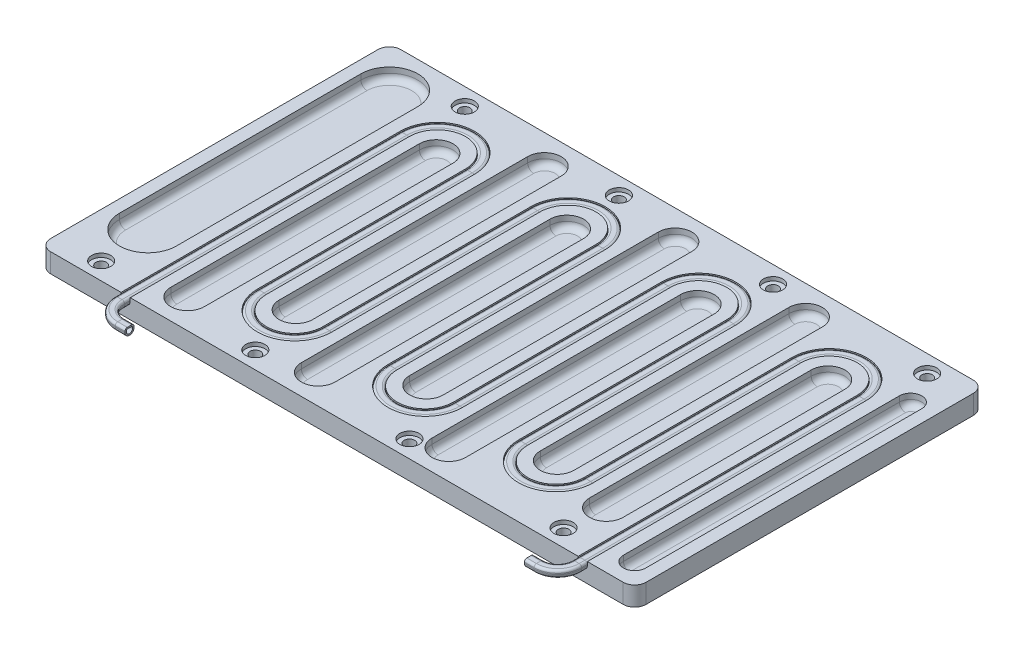
from build123d import *

# Parameters (mm, degrees)
SKETCH1_W           = 310
SKETCH1_H           = 182.3
BOSS_EXTRUDE1_DEPTH = 10
HOLE1_D             = 5.5
HOLE1_DEPTH         = 10
HOLE1_CBORE_D       = 10
HOLE1_CBORE_DEPTH   = 2
HOLE1_TIP           = 1.652366702
FILLET1_R           = 6
CUT_EXTRUDE1_DEPTH  = 6
FILLET2_R           = 3.175


with BuildPart() as part:
    # Sketch1 → Boss-Extrude1 (new body)
    with BuildSketch(Plane(origin=(0, 0, 0), x_dir=(1, 0, 0), z_dir=(0, 1, 0))):
        Rectangle(SKETCH1_W, SKETCH1_H)
    extrude(amount=BOSS_EXTRUDE1_DEPTH)

    # Hole1
    with Locations(Plane(origin=(0, 10, 0), x_dir=(1, 0, 0), z_dir=(0, 1, 0))):
        with Locations((-131.75, -82.15), (-106.75, 82.15), (-26.5, 82.15), (53.75, 82.15), (134, 82.15), (-51.5, -82.15), (28.75, -82.15), (109, -82.15)):
            CounterBoreHole(HOLE1_D / 2, HOLE1_CBORE_D / 2, HOLE1_CBORE_DEPTH, depth=HOLE1_DEPTH)
            with Locations((0, 0, -(HOLE1_DEPTH + HOLE1_TIP / 2))):  # 118° drill point
                Cone(0, HOLE1_D / 2, HOLE1_TIP, mode=Mode.SUBTRACT)

    # Fillet1
    fillet1_edges = [part.edges().sort_by_distance(p)[0] for p in [
        (155, 5, -91.15),
        (155, 5, 91.15),
        (-155, 5, -91.15),
        (-155, 5, 91.15),
    ]]
    fillet(fillet1_edges, radius=FILLET1_R)

    # Cut-Sweep1: sweep along a path in Sketch6
    with BuildLine(Plane(origin=(0, 10, 0), x_dir=(1, 0, 0), z_dir=(0, 1, 0))) as cut_sweep1_path:
        Line((-95, -104.15), (-100, -104.15))
        ThreePointArc((-100, -104.15), (-107.071067812, -101.221067812), (-110, -94.15))
        Line((-110, -94.15), (-110, -91.15))
        Line((-110, -91.15), (-110, 54.15))
        ThreePointArc((-110, 54.15), (-93, 71.15), (-76, 54.15))
        Line((-76, 54.15), (-76, -54.15))
        ThreePointArc((-76, -54.15), (-59, -71.15), (-42, -54.15))
        Line((-42, -54.15), (-42, 54.15))
        ThreePointArc((-42, 54.15), (-25, 71.15), (-8, 54.15))
        Line((-8, 54.15), (-8, -54.15))
        ThreePointArc((-8, -54.15), (9, -71.15), (26, -54.15))
        Line((26, -54.15), (26, 54.15))
        ThreePointArc((26, 54.15), (43, 71.15), (60, 54.15))
        Line((60, 54.15), (60, -54.15))
        ThreePointArc((60, -54.15), (77, -71.15), (94, -54.15))
        Line((94, -54.15), (94, 54.15))
        ThreePointArc((94, 54.15), (111, 71.15), (128, 54.15))
        Line((128, 54.15), (128, -91.15))
        Line((128, -91.15), (128, -94.15))
        ThreePointArc((128, -94.15), (125.071067812, -101.221067812), (118, -104.15))
        Line((118, -104.15), (113, -104.15))
    # Sketch7 → Cut-Sweep1 (sweep, cut)
    with BuildSketch(Plane.XY.offset(91.15)):
        with BuildLine():
            Line((-112.38125, 8.2), (-112.38125, 10))
            Line((-112.38125, 10), (-107.61875, 10))
            Line((-107.61875, 10), (-107.61875, 8.2))
            ThreePointArc((-107.61875, 8.2), (-110, 5.81875), (-112.38125, 8.2))
        make_face()
    sweep(path=cut_sweep1_path.line, mode=Mode.SUBTRACT)

    # Sketch9 → Cut-Extrude1 (cut)
    with BuildSketch(Plane(origin=(0, 10, 0), x_dir=(1, 0, 0), z_dir=(0, 1, 0))):
        with BuildLine():
            Line((-148.5, 69.840625), (-148.5, -55.840625))
            ThreePointArc((-148.5, -55.840625), (-133.690625, -70.65), (-118.88125, -55.840625))
            Line((-118.88125, -55.840625), (-118.88125, 69.840625))
            ThreePointArc((-118.88125, 69.840625), (-133.690625, 84.65), (-148.5, 69.840625))
        make_face()
        with BuildLine():
            Line((-101.75, 53.51875), (-101.75, -75.9))
            ThreePointArc((-101.75, -75.9), (-93, -84.65), (-84.25, -75.9))
            Line((-84.25, -75.9), (-84.25, 53.51875))
            ThreePointArc((-84.25, 53.51875), (-93, 62.26875), (-101.75, 53.51875))
        make_face()
        with BuildLine():
            Line((-67.75, 75.9), (-67.75, -53.51875))
            ThreePointArc((-67.75, -53.51875), (-59, -62.26875), (-50.25, -53.51875))
            Line((-50.25, -53.51875), (-50.25, 75.9))
            ThreePointArc((-50.25, 75.9), (-59, 84.65), (-67.75, 75.9))
        make_face()
        with BuildLine():
            Line((-33.75, -75.9), (-33.75, 53.51875))
            ThreePointArc((-33.75, 53.51875), (-25, 62.26875), (-16.25, 53.51875))
            Line((-16.25, 53.51875), (-16.25, -75.9))
            ThreePointArc((-16.25, -75.9), (-25, -84.65), (-33.75, -75.9))
        make_face()
        with BuildLine():
            Line((0.25, 75.9), (0.25, -53.51875))
            ThreePointArc((0.25, -53.51875), (9, -62.26875), (17.75, -53.51875))
            Line((17.75, -53.51875), (17.75, 75.9))
            ThreePointArc((17.75, 75.9), (9, 84.65), (0.25, 75.9))
        make_face()
        with BuildLine():
            Line((34.25, -75.9), (34.25, 53.51875))
            ThreePointArc((34.25, 53.51875), (43, 62.26875), (51.75, 53.51875))
            Line((51.75, 53.51875), (51.75, -75.9))
            ThreePointArc((51.75, -75.9), (43, -84.65), (34.25, -75.9))
        make_face()
        with BuildLine():
            Line((68.25, 75.9), (68.25, -53.51875))
            ThreePointArc((68.25, -53.51875), (77, -62.26875), (85.75, -53.51875))
            Line((85.75, -53.51875), (85.75, 75.9))
            ThreePointArc((85.75, 75.9), (77, 84.65), (68.25, 75.9))
        make_face()
        with BuildLine():
            Line((102.25, -61.9), (102.25, 53.51875))
            ThreePointArc((102.25, 53.51875), (111, 62.26875), (119.75, 53.51875))
            Line((119.75, 53.51875), (119.75, -61.9))
            ThreePointArc((119.75, -61.9), (111, -70.65), (102.25, -61.9))
        make_face()
        with BuildLine():
            Line((136.88125, 64.840625), (136.88125, -78.840625))
            ThreePointArc((136.88125, -78.840625), (142.690625, -84.65), (148.5, -78.840625))
            Line((148.5, -78.840625), (148.5, 64.840625))
            ThreePointArc((148.5, 64.840625), (142.690625, 70.65), (136.88125, 64.840625))
        make_face()
    extrude(amount=-CUT_EXTRUDE1_DEPTH, mode=Mode.SUBTRACT)

    # Fillet2
    fillet2_edges = [part.edges().sort_by_distance(p)[0] for p in [
        (148.5, 4, 7),
        (142.690625, 4, 84.65),
        (136.88125, 4, 7),
        (142.690625, 4, -70.65),
        (102.25, 4, 4.190625),
        (111, 4, -62.26875),
        (119.75, 4, 4.190625),
        (111, 4, 70.65),
        (85.75, 4, -11.190625),
        (77, 4, 62.26875),
        (68.25, 4, -11.190625),
        (77, 4, -84.65),
        (34.25, 4, 11.190625),
        (43, 4, -62.26875),
        (51.75, 4, 11.190625),
        (43, 4, 84.65),
        (17.75, 4, -11.190625),
        (9, 4, 62.26875),
        (0.25, 4, -11.190625),
        (9, 4, -84.65),
        (-33.75, 4, 11.190625),
        (-25, 4, -62.26875),
        (-16.25, 4, 11.190625),
        (-25, 4, 84.65),
        (-50.25, 4, -11.190625),
        (-59, 4, 62.26875),
        (-67.75, 4, -11.190625),
        (-59, 4, -84.65),
        (-84.25, 4, 11.190625),
        (-93, 4, 84.65),
        (-101.75, 4, 11.190625),
        (-93, 4, -62.26875),
        (-118.88125, 4, -7),
        (-133.690625, 4, 70.65),
        (-148.5, 4, -7),
        (-133.690625, 4, -84.65),
    ]]
    fillet(fillet2_edges, radius=FILLET2_R)


with BuildPart() as body_2:
    # Sweep1: sweep along a path in Sketch6<2>
    with BuildLine(Plane(origin=(0, 10, 0), x_dir=(1, 0, 0), z_dir=(0, 1, 0))) as sweep1_path:
        Line((-95, -104.15), (-100, -104.15))
        ThreePointArc((-100, -104.15), (-107.071067812, -101.221067812), (-110, -94.15))
        Line((-110, -94.15), (-110, -91.15))
        Line((-110, -91.15), (-110, 54.15))
        ThreePointArc((-110, 54.15), (-93, 71.15), (-76, 54.15))
        Line((-76, 54.15), (-76, -54.15))
        ThreePointArc((-76, -54.15), (-59, -71.15), (-42, -54.15))
        Line((-42, -54.15), (-42, 54.15))
        ThreePointArc((-42, 54.15), (-25, 71.15), (-8, 54.15))
        Line((-8, 54.15), (-8, -54.15))
        ThreePointArc((-8, -54.15), (9, -71.15), (26, -54.15))
        Line((26, -54.15), (26, 54.15))
        ThreePointArc((26, 54.15), (43, 71.15), (60, 54.15))
        Line((60, 54.15), (60, -54.15))
        ThreePointArc((60, -54.15), (77, -71.15), (94, -54.15))
        Line((94, -54.15), (94, 54.15))
        ThreePointArc((94, 54.15), (111, 71.15), (128, 54.15))
        Line((128, 54.15), (128, -91.15))
        Line((128, -91.15), (128, -94.15))
        ThreePointArc((128, -94.15), (125.071067812, -101.221067812), (118, -104.15))
        Line((118, -104.15), (113, -104.15))
    # Sketch8 → Sweep1 (sweep)
    with BuildSketch(Plane.XY.offset(91.15)):
        with BuildLine():
            Line((-112.38125, 8.2), (-112.38125, 8.75))
            ThreePointArc((-112.38125, 8.75), (-112.015133476, 9.633883476), (-111.13125, 10))
            Line((-111.13125, 10), (-108.86875, 10))
            ThreePointArc((-108.86875, 10), (-107.984866524, 9.633883476), (-107.61875, 8.75))
            Line((-107.61875, 8.75), (-107.61875, 8.2))
            ThreePointArc((-107.61875, 8.2), (-110, 5.81875), (-112.38125, 8.2))
        make_face()
        with BuildLine():
            Line((-111.61925, 8.2), (-111.61925, 8.838))
            ThreePointArc((-111.61925, 8.838), (-111.502092712, 9.120842712), (-111.21925, 9.238))
            Line((-111.21925, 9.238), (-108.78075, 9.238))
            ThreePointArc((-108.78075, 9.238), (-108.497907288, 9.120842712), (-108.38075, 8.838))
            Line((-108.38075, 8.838), (-108.38075, 8.2))
            ThreePointArc((-108.38075, 8.2), (-110, 6.58075), (-111.61925, 8.2))
        make_face(mode=Mode.SUBTRACT)
    sweep(path=sweep1_path.line)


solid = Compound([part.part, body_2.part])
